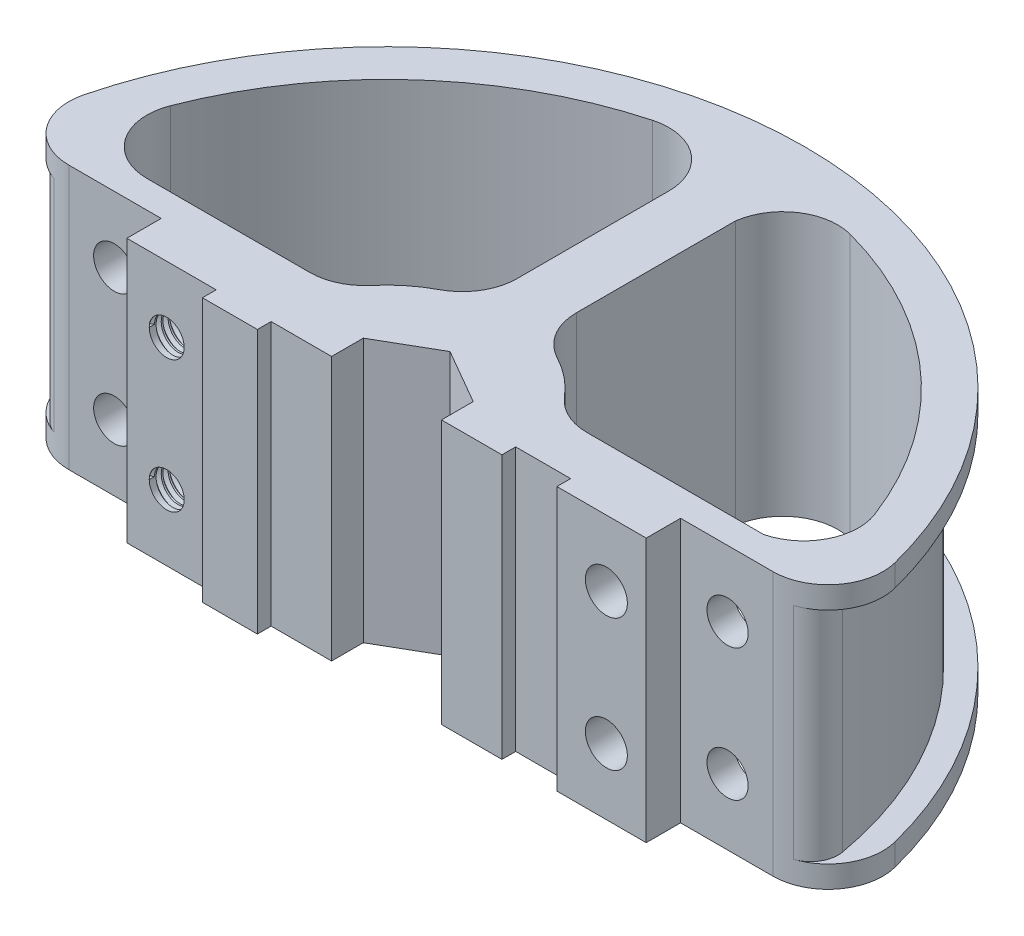
from build123d import *
from build123d.topology import SkipClean

# Parameters (mm, degrees)
BOSS_EXTRUDE1_DEPTH = 30.48
SKETCH4_W           = 10.979322836
SKETCH4_H           = 25.4
FILLET2_R           = 3.175
SKETCH5_R           = 2.38125
CUT_EXTRUDE1_DEPTH  = 12.7
SKETCH6_R           = 2.0193
SKETCH6_R_2         = 2.4257
CUT_EXTRUDE2_DEPTH  = 12.7
THREAD1_PITCH       = 0.79375
THREAD2_PITCH       = 0.79375


with BuildPart() as part:
    # Sketch1 → Boss-Extrude1 (new body)
    with BuildSketch(Plane(origin=(0, 0, 0), x_dir=(1, 0, 0), z_dir=(0, 1, 0))):
        with BuildLine():
            ThreePointArc((-40.685354867, 3.96875), (-45.697109488, 6.419414721), (-46.840476633, 11.879831694))
            ThreePointArc((-46.840476633, 11.879831694), (0, 48.3235), (46.840476633, 11.879831694))
            ThreePointArc((46.840476633, 11.879831694), (45.697109488, 6.419414721), (40.685354867, 3.96875))
            Line((40.685354867, 3.96875), (30.00375, 3.96875))
            Line((30.00375, 3.96875), (30.00375, 0))
            Line((30.00375, 0), (19.685, 0))
            Line((19.685, 0), (19.685, 1.5875))
            Line((19.685, 1.5875), (13.335, 1.5875))
            Line((13.335, 1.5875), (13.335, 0))
            Line((13.335, 0), (6.35, 0))
            Line((6.35, 0), (6.35, 3.666174209))
            Line((6.35, 3.666174209), (0, 7.332348419))
            Line((0, 7.332348419), (-6.35, 3.666174209))
            Line((-6.35, 3.666174209), (-6.35, 0))
            Line((-6.35, 0), (-13.335, 0))
            Line((-13.335, 0), (-13.335, -1.5875))
            Line((-13.335, -1.5875), (-19.685, -1.5875))
            Line((-19.685, -1.5875), (-19.685, 0))
            Line((-19.685, 0), (-30.00375, 0))
            Line((-30.00375, 0), (-30.00375, 3.96875))
            Line((-30.00375, 3.96875), (-40.685354867, 3.96875))
        make_face()
        with BuildLine():
            ThreePointArc((-16.013303795, 7.14375), (-13.335678645, 7.735901135), (-11.157442084, 9.40191581))
            ThreePointArc((-11.157442084, 9.40191581), (-9.152291525, 11.363102331), (-6.808929497, 12.904379638))
            ThreePointArc((-6.808929497, 12.904379638), (-4.334447706, 15.24140505), (-3.422262831, 18.52053095))
            Line((-3.422262831, 18.52053095), (-3.422262831, 36.047125415))
            ThreePointArc((-3.422262831, 36.047125415), (-5.914023629, 41.090585562), (-11.433755826, 42.175905149))
            ThreePointArc((-11.433755826, 42.175905149), (-29.236545476, 32.477102027), (-40.746504, 15.787975145))
            ThreePointArc((-40.746504, 15.787975145), (-40.064274454, 9.905284428), (-34.82543729, 7.14375))
            Line((-34.82543729, 7.14375), (-16.013303795, 7.14375))
        make_face(mode=Mode.SUBTRACT)
        with BuildLine():
            ThreePointArc((3.422262831, 18.52053095), (4.334447706, 15.24140505), (6.808929497, 12.904379638))
            ThreePointArc((6.808929497, 12.904379638), (9.152291525, 11.363102331), (11.157442084, 9.40191581))
            ThreePointArc((11.157442084, 9.40191581), (13.335678645, 7.735901135), (16.013303795, 7.14375))
            Line((16.013303795, 7.14375), (36.414632198, 7.14375))
            ThreePointArc((36.414632198, 7.14375), (40.521366458, 10.363260972), (40.829358622, 15.572450736))
            ThreePointArc((40.829358622, 15.572450736), (29.29790538, 32.421759479), (11.37038908, 42.193032595))
            ThreePointArc((11.37038908, 42.193032595), (6.193484497, 41.343767012), (3.422262831, 36.8893396))
            Line((3.422262831, 36.8893396), (3.422262831, 18.52053095))
        make_face(mode=Mode.SUBTRACT)
    extrude(amount=BOSS_EXTRUDE1_DEPTH)

    # Sketch4 → Cut-Revolve1 (revolve, cut)
    with BuildSketch(Plane.XY):
        with Locations((-51.001016285, 15.24)):
            Rectangle(SKETCH4_W, SKETCH4_H)
    revolve(axis=Axis((0, -4.357371991, 0), (0, 1, 0)), mode=Mode.SUBTRACT)

    # Fillet2
    fillet2_edges = [part.edges().sort_by_distance(p)[0] for p in [
        (45.140984743, 15.24, -5.794386795),
        (-45.140984743, 15.24, -5.794386795),
    ]]
    fillet(fillet2_edges, radius=FILLET2_R)

    # Sketch5 → Cut-Extrude1 (cut)
    with BuildSketch(Plane.XY):
        with Locations((-35.433, 22.86)):
            Circle(SKETCH5_R)
        with Locations((-35.433, 7.62)):
            Circle(SKETCH5_R)
        with Locations(Location((35.433, 22.86, 0), (0, 0, 65.654751718))):
            Circle(SKETCH5_R)
        with Locations(Location((35.433, 7.62, 0), (0, 0, 294.345248282))):
            Circle(SKETCH5_R)
    extrude(amount=-CUT_EXTRUDE1_DEPTH, mode=Mode.SUBTRACT)

    # Sketch6 → Cut-Extrude2 (cut)
    with BuildSketch(Plane.XY):
        with Locations((-25.4, 22.86)):
            Circle(SKETCH6_R)
        with Locations((-25.4, 7.62)):
            Circle(SKETCH6_R)
        with Locations((25.4, 7.62)):
            Circle(SKETCH6_R_2)
        with Locations((25.4, 22.86)):
            Circle(SKETCH6_R_2)
    extrude(amount=-CUT_EXTRUDE2_DEPTH, mode=Mode.SUBTRACT)

    # Thread1: the profile of Thread Profile1 profile screwed along a right-hand helix of 12.598425 turns, 8 arcs to a turn; built about Z, then put on its axis
    with SkipClean():  # the faces are left unmerged after this step: merging them gives an invalid solid
        thread1_z = Axis((0, 0, 0), (0, 0, 1))
        thread1_corners = [(2.019, 0, -0.000173205), (2.448929788, 0, 0.248046874), (2.448929788, 0, 0.347265624), (2.019, 0, 0.595485703)]
        with BuildLine(mode=Mode.PRIVATE) as thread1_profile:
            Line(thread1_corners[0], thread1_corners[1])
            Line(thread1_corners[1], thread1_corners[2])
            Line(thread1_corners[2], thread1_corners[3])
            Line(thread1_corners[3], thread1_corners[0])
        thread1_cap = Face(thread1_profile.wire())
        thread1_turn_angles = [0, 22.5, 45, 67.5, 90, 112.5, 135, 157.5, 180, 202.5, 225, 247.5, 270, 292.5, 315, 337.5, 360]
        thread1_turn_weights = [1, 0.9238795325112867, 1, 0.9238795325112867, 1, 0.9238795325112867, 1, 0.9238795325112867, 1, 0.9238795325112867, 1, 0.9238795325112867, 1, 0.9238795325112867, 1, 0.9238795325112867, 1]
        thread1_turn_rails = [Edge.make_bspline([Vector(p[0], p[1], 0).rotate(thread1_z, thread1_turn_angles[k]) / thread1_turn_weights[k] + Vector(0, 0, p[2] + THREAD1_PITCH * thread1_turn_angles[k] / 360) for k in range(17)], [0, 0, 0, 1, 1, 2, 2, 3, 3, 4, 4, 5, 5, 6, 6, 7, 7, 8, 8, 8], 2, thread1_turn_weights) for p in thread1_corners]
        thread1_turn_sides = [Face.make_surface_from_curves(thread1_turn_rails[p[0]], thread1_turn_rails[p[1]]) for p in [(0, 1), (1, 2), (2, 3), (3, 0)]]
        thread1_last_angles = [4320, 4342.5, 4365, 4387.5, 4410, 4432.5, 4455, 4477.5, 4500, 4517.716535433, 4535.433070866]
        thread1_last_weights = [1, 0.9238795325112867, 1, 0.9238795325112867, 1, 0.9238795325112867, 1, 0.9238795325112867, 1, 0.9525736983244454, 1]
        thread1_last_rails = [Edge.make_bspline([Vector(p[0], p[1], 0).rotate(thread1_z, thread1_last_angles[k]) / thread1_last_weights[k] + Vector(0, 0, p[2] + THREAD1_PITCH * thread1_last_angles[k] / 360) for k in range(11)], [0, 0, 0, 1, 1, 2, 2, 3, 3, 4, 4, 5, 5, 5], 2, thread1_last_weights) for p in thread1_corners]
        thread1_last_sides = [Face.make_surface_from_curves(thread1_last_rails[p[0]], thread1_last_rails[p[1]]) for p in [(0, 1), (1, 2), (2, 3), (3, 0)]]
        thread1 = Plane(origin=(-25.4, 22.86, 0), x_dir=(-1, 0, 0), z_dir=(0, 0, -1)) * Solid(Shell([*[p.moved(Location((0, 0, THREAD1_PITCH * i))) for i in range(12) for p in thread1_turn_sides], *thread1_last_sides, thread1_cap, thread1_cap.rotate(thread1_z, 4535.433070866).moved(Location((0, 0, THREAD1_PITCH * 4535.433070866 / 360)))]))
        add(thread1, mode=Mode.SUBTRACT)

    # Thread2: the profile of Thread Profile2 profile screwed along a right-hand helix of 12.598425 turns, 8 arcs to a turn; built about Z, then put on its axis
    with SkipClean():  # the faces are left unmerged after this step: merging them gives an invalid solid
        thread2_z = Axis((0, 0, 0), (0, 0, 1))
        thread2_corners = [(2.019, 0, -0.000173205), (2.448929788, 0, 0.248046874), (2.448929788, 0, 0.347265624), (2.019, 0, 0.595485703)]
        with BuildLine(mode=Mode.PRIVATE) as thread2_profile:
            Line(thread2_corners[0], thread2_corners[1])
            Line(thread2_corners[1], thread2_corners[2])
            Line(thread2_corners[2], thread2_corners[3])
            Line(thread2_corners[3], thread2_corners[0])
        thread2_cap = Face(thread2_profile.wire())
        thread2_turn_angles = [0, 22.5, 45, 67.5, 90, 112.5, 135, 157.5, 180, 202.5, 225, 247.5, 270, 292.5, 315, 337.5, 360]
        thread2_turn_weights = [1, 0.9238795325112867, 1, 0.9238795325112867, 1, 0.9238795325112867, 1, 0.9238795325112867, 1, 0.9238795325112867, 1, 0.9238795325112867, 1, 0.9238795325112867, 1, 0.9238795325112867, 1]
        thread2_turn_rails = [Edge.make_bspline([Vector(p[0], p[1], 0).rotate(thread2_z, thread2_turn_angles[k]) / thread2_turn_weights[k] + Vector(0, 0, p[2] + THREAD2_PITCH * thread2_turn_angles[k] / 360) for k in range(17)], [0, 0, 0, 1, 1, 2, 2, 3, 3, 4, 4, 5, 5, 6, 6, 7, 7, 8, 8, 8], 2, thread2_turn_weights) for p in thread2_corners]
        thread2_turn_sides = [Face.make_surface_from_curves(thread2_turn_rails[p[0]], thread2_turn_rails[p[1]]) for p in [(0, 1), (1, 2), (2, 3), (3, 0)]]
        thread2_last_angles = [4320, 4342.5, 4365, 4387.5, 4410, 4432.5, 4455, 4477.5, 4500, 4517.716535433, 4535.433070866]
        thread2_last_weights = [1, 0.9238795325112867, 1, 0.9238795325112867, 1, 0.9238795325112867, 1, 0.9238795325112867, 1, 0.9525736983244454, 1]
        thread2_last_rails = [Edge.make_bspline([Vector(p[0], p[1], 0).rotate(thread2_z, thread2_last_angles[k]) / thread2_last_weights[k] + Vector(0, 0, p[2] + THREAD2_PITCH * thread2_last_angles[k] / 360) for k in range(11)], [0, 0, 0, 1, 1, 2, 2, 3, 3, 4, 4, 5, 5, 5], 2, thread2_last_weights) for p in thread2_corners]
        thread2_last_sides = [Face.make_surface_from_curves(thread2_last_rails[p[0]], thread2_last_rails[p[1]]) for p in [(0, 1), (1, 2), (2, 3), (3, 0)]]
        thread2 = Plane(origin=(-25.4, 7.62, 0), x_dir=(-1, 0, 0), z_dir=(0, 0, -1)) * Solid(Shell([*[p.moved(Location((0, 0, THREAD2_PITCH * i))) for i in range(12) for p in thread2_turn_sides], *thread2_last_sides, thread2_cap, thread2_cap.rotate(thread2_z, 4535.433070866).moved(Location((0, 0, THREAD2_PITCH * 4535.433070866 / 360)))]))
        add(thread2, mode=Mode.SUBTRACT)


solid = part.part
